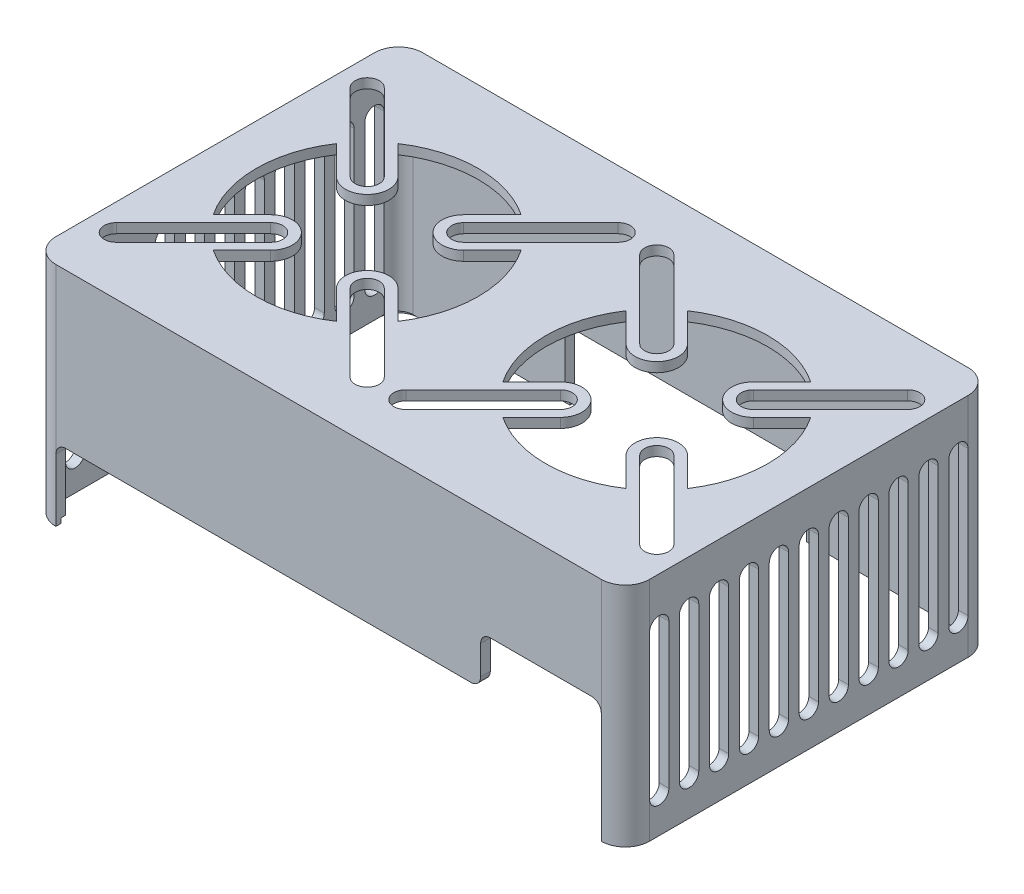
from build123d import *

# Parameters (mm, degrees)
BOSS_EXTRUDE1_DEPTH = 45
CUT_EXTRUDE2_START  = -45
CUT_EXTRUDE2_DEPTH  = 1
CUT_EXTRUDE3_REACH  = 109.626
SKETCH3_W           = 50
SKETCH3_H           = 15
CUT_EXTRUDE4_REACH  = 109.626
SKETCH4_W           = 113
SKETCH4_H           = 15
CUT_EXTRUDE6_DEPTH  = 137.374484417
LPATTERN2_COUNT     = 11
LPATTERN2_PITCH     = 6.2
BOSS_EXTRUDE2_DEPTH = 2
CUT_EXTRUDE7_DEPTH  = 87.227895718
SKETCH8_W           = 25
SKETCH8_H           = 10
CUT_EXTRUDE8_DEPTH  = 2
FILLET1_R           = 2
FILLET2_R           = 2
FILLET3_R           = 2
FILLET4_R           = 2


with BuildPart() as part:
    # Sketch1 → Boss-Extrude1 (new body)
    with BuildSketch(Plane(origin=(0, 0, 0), x_dir=(1, 0, 0), z_dir=(0, 1, 0))):
        with BuildLine():
            Line((-56.5, -38), (56.5, -38))
            ThreePointArc((56.5, -38), (60.035533906, -36.535533906), (61.5, -33))
            Line((61.5, -33), (61.5, 33))
            ThreePointArc((61.5, 33), (60.035533906, 36.535533906), (56.5, 38))
            Line((56.5, 38), (-56.5, 38))
            ThreePointArc((-56.5, 38), (-60.035533906, 36.535533906), (-61.5, 33))
            Line((-61.5, 33), (-61.5, -33))
            ThreePointArc((-61.5, -33), (-60.035533906, -36.535533906), (-56.5, -38))
        make_face()
        with BuildLine():
            Line((-59.5, -33), (-59.5, 33))
            ThreePointArc((-59.5, 33), (-58.621320344, 35.121320344), (-56.5, 36))
            Line((-56.5, 36), (56.5, 36))
            ThreePointArc((56.5, 36), (58.621320344, 35.121320344), (59.5, 33))
            Line((59.5, 33), (59.5, -33))
            ThreePointArc((59.5, -33), (58.621320344, -35.121320344), (56.5, -36))
            Line((56.5, -36), (-56.5, -36))
            ThreePointArc((-56.5, -36), (-58.621320344, -35.121320344), (-59.5, -33))
        make_face(mode=Mode.SUBTRACT)
    extrude(amount=BOSS_EXTRUDE1_DEPTH)

    # Sketch2 → Cut-Extrude2 (cut)
    with BuildSketch(Plane(origin=(0, 45, 0), x_dir=(1, 0, 0), z_dir=(0, 1, 0)).offset(CUT_EXTRUDE2_START)):
        with BuildLine():
            Line((-56.5, -37), (56.5, -37))
            ThreePointArc((56.5, -37), (59.328427125, -35.828427125), (60.5, -33))
            Line((60.5, -33), (60.5, 33))
            ThreePointArc((60.5, 33), (59.328427125, 35.828427125), (56.5, 37))
            Line((56.5, 37), (-56.5, 37))
            ThreePointArc((-56.5, 37), (-59.328427125, 35.828427125), (-60.5, 33))
            Line((-60.5, 33), (-60.5, -33))
            ThreePointArc((-60.5, -33), (-59.328427125, -35.828427125), (-56.5, -37))
        make_face()
        with BuildLine():
            Line((-59.5, 33), (-59.5, -33))
            ThreePointArc((-59.5, -33), (-58.621320344, -35.121320344), (-56.5, -36))
            Line((-56.5, -36), (56.5, -36))
            ThreePointArc((56.5, -36), (58.621320344, -35.121320344), (59.5, -33))
            Line((59.5, -33), (59.5, 33))
            ThreePointArc((59.5, 33), (58.621320344, 35.121320344), (56.5, 36))
            Line((56.5, 36), (-56.5, 36))
            ThreePointArc((-56.5, 36), (-58.621320344, 35.121320344), (-59.5, 33))
        make_face(mode=Mode.SUBTRACT)
    extrude(amount=CUT_EXTRUDE2_DEPTH, mode=Mode.SUBTRACT)

    # Cut-Extrude3: up to this face of the body (flat: up to its plane)
    cut_extrude3_end = Plane(part.part.faces().sort_by_distance((0, 23, -36))[0])
    # Sketch3 → Cut-Extrude3 (cut, up to the picked face)
    with BuildSketch(Plane(origin=(0, 0, -38), x_dir=(-1, 0, 0), z_dir=(0, 0, -1)), mode=Mode.PRIVATE) as cut_extrude3_sk1:
        with Locations((0, 7.5)):
            Rectangle(SKETCH3_W, SKETCH3_H)
    cut_extrude3_tool1 = split(extrude(cut_extrude3_sk1.sketch, amount=-CUT_EXTRUDE3_REACH, mode=Mode.PRIVATE), bisect_by=cut_extrude3_end, keep=Keep.BOTH, mode=Mode.PRIVATE)
    add(cut_extrude3_tool1.solids().sort_by(Axis((0, 7.5, -38), (0, 0, 1)))[0], mode=Mode.SUBTRACT)

    # Cut-Extrude4: up to this face of the body (flat: up to its plane)
    cut_extrude4_end = Plane(part.part.faces().sort_by_distance((0, 23, 36))[0])
    # Sketch4 → Cut-Extrude4 (cut, up to the picked face)
    with BuildSketch(Plane.XY.offset(38), mode=Mode.PRIVATE) as cut_extrude4_sk1:
        with Locations((0, 7.5)):
            Rectangle(SKETCH4_W, SKETCH4_H)
    cut_extrude4_tool1 = split(extrude(cut_extrude4_sk1.sketch, amount=-CUT_EXTRUDE4_REACH, mode=Mode.PRIVATE), bisect_by=cut_extrude4_end, keep=Keep.BOTH, mode=Mode.PRIVATE)
    add(cut_extrude4_tool1.solids().sort_by(Axis((0, 7.5, 38), (0, 0, -1)))[0], mode=Mode.SUBTRACT)

    # Sketch5 → Cut-Extrude6 (cut, symmetric)
    with BuildSketch(Plane.ZY.offset(61.5)):
        with BuildLine():
            Line((-29, 37.5), (-29, 7.5))
            ThreePointArc((-29, 7.5), (-31, 5.5), (-33, 7.5))
            Line((-33, 7.5), (-33, 37.5))
            ThreePointArc((-33, 37.5), (-31, 39.5), (-29, 37.5))
        make_face()
    cut_extrude6 = extrude(amount=CUT_EXTRUDE6_DEPTH, both=True, mode=Mode.SUBTRACT)

    # LPattern2: Cut-Extrude6 ×11
    with Locations(*[(0, 0, i * LPATTERN2_PITCH) for i in range(1, LPATTERN2_COUNT)]):
        add(cut_extrude6, mode=Mode.SUBTRACT)

    # Sketch6 → Boss-Extrude2 (add)
    with BuildSketch(Plane(origin=(0, 45, 0), x_dir=(1, 0, 0), z_dir=(0, 1, 0))):
        with BuildLine():
            Line((-56.5, -38), (56.5, -38))
            ThreePointArc((56.5, -38), (60.035533906, -36.535533906), (61.5, -33))
            Line((61.5, -33), (61.5, 33))
            ThreePointArc((61.5, 33), (60.035533906, 36.535533906), (56.5, 38))
            Line((56.5, 38), (-56.5, 38))
            ThreePointArc((-56.5, 38), (-60.035533906, 36.535533906), (-61.5, 33))
            Line((-61.5, 33), (-61.5, -33))
            ThreePointArc((-61.5, -33), (-60.035533906, -36.535533906), (-56.5, -38))
        make_face()
    extrude(amount=BOSS_EXTRUDE2_DEPTH)

    # Sketch7 → Cut-Extrude7 (cut, through all)
    with BuildSketch(Plane(origin=(0, 47, 0), x_dir=(1, 0, 0), z_dir=(0, 1, 0))):
        with BuildLine():
            ThreePointArc((-17.232842608, 19.131118423), (-30, 23), (-42.767157392, 19.131118423))
            Line((-42.767157392, 19.131118423), (-36.818019485, 13.181980515))
            ThreePointArc((-36.818019485, 13.181980515), (-36.818019485, 6.818019485), (-43.181980515, 6.818019485))
            Line((-43.181980515, 6.818019485), (-49.131118423, 12.767157392))
            ThreePointArc((-49.131118423, 12.767157392), (-53, 0), (-49.131118423, -12.767157392))
            Line((-49.131118423, -12.767157392), (-43.181980515, -6.818019485))
            ThreePointArc((-43.181980515, -6.818019485), (-36.818019485, -6.818019485), (-36.818019485, -13.181980515))
            Line((-36.818019485, -13.181980515), (-42.767157392, -19.131118423))
            ThreePointArc((-42.767157392, -19.131118423), (-30, -23), (-17.232842608, -19.131118423))
            Line((-17.232842608, -19.131118423), (-23.181980515, -13.181980515))
            ThreePointArc((-23.181980515, -13.181980515), (-23.181980515, -6.818019485), (-16.818019485, -6.818019485))
            Line((-16.818019485, -6.818019485), (-10.868881577, -12.767157392))
            ThreePointArc((-10.868881577, -12.767157392), (-7.988460711, -6.670242734), (-7, 0))
            ThreePointArc((-7, 0), (-7.988460711, 6.670242734), (-10.868881577, 12.767157392))
            Line((-10.868881577, 12.767157392), (-16.818019485, 6.818019485))
            ThreePointArc((-16.818019485, 6.818019485), (-23.181980515, 6.818019485), (-23.181980515, 13.181980515))
            Line((-23.181980515, 13.181980515), (-17.232842608, 19.131118423))
        make_face()
        with BuildLine():
            Line((-41.767766953, -8.232233047), (-47.934863167, -14.399329261))
            ThreePointArc((-47.934863167, -14.399329261), (-46.263455967, -16.263455967), (-44.399329261, -17.934863167))
            Line((-44.399329261, -17.934863167), (-38.232233047, -11.767766953))
            ThreePointArc((-38.232233047, -11.767766953), (-38.232233047, -8.232233047), (-41.767766953, -8.232233047))
        make_face()
        with BuildLine():
            ThreePointArc((-44.399329261, -17.934863167), (-46.263455967, -16.263455967), (-47.934863167, -14.399329261))
            Line((-47.934863167, -14.399329261), (-57.767766953, -24.232233047))
            ThreePointArc((-57.767766953, -24.232233047), (-57.767766953, -27.767766953), (-54.232233047, -27.767766953))
            Line((-54.232233047, -27.767766953), (-44.399329261, -17.934863167))
        make_face()
        with BuildLine():
            Line((-2.232233047, -24.232233047), (-12.065136833, -14.399329261))
            ThreePointArc((-12.065136833, -14.399329261), (-13.736544033, -16.263455967), (-15.600670739, -17.934863167))
            Line((-15.600670739, -17.934863167), (-5.767766953, -27.767766953))
            ThreePointArc((-5.767766953, -27.767766953), (-2.232233047, -27.767766953), (-2.232233047, -24.232233047))
        make_face()
        with BuildLine():
            ThreePointArc((-15.600670739, -17.934863167), (-13.736544033, -16.263455967), (-12.065136833, -14.399329261))
            Line((-12.065136833, -14.399329261), (-18.232233047, -8.232233047))
            ThreePointArc((-18.232233047, -8.232233047), (-21.767766953, -8.232233047), (-21.767766953, -11.767766953))
            Line((-21.767766953, -11.767766953), (-15.600670739, -17.934863167))
        make_face()
        with BuildLine():
            ThreePointArc((-12.065136833, 14.399329261), (-13.736544033, 16.263455967), (-15.600670739, 17.934863167))
            Line((-15.600670739, 17.934863167), (-21.767766953, 11.767766953))
            ThreePointArc((-21.767766953, 11.767766953), (-21.767766953, 8.232233047), (-18.232233047, 8.232233047))
            Line((-18.232233047, 8.232233047), (-12.065136833, 14.399329261))
        make_face()
        with BuildLine():
            Line((-5.767766953, 27.767766953), (-15.600670739, 17.934863167))
            ThreePointArc((-15.600670739, 17.934863167), (-13.736544033, 16.263455967), (-12.065136833, 14.399329261))
            Line((-12.065136833, 14.399329261), (-2.232233047, 24.232233047))
            ThreePointArc((-2.232233047, 24.232233047), (-2.232233047, 27.767766953), (-5.767766953, 27.767766953))
        make_face()
        with BuildLine():
            Line((-44.399329261, 17.934863167), (-54.232233047, 27.767766953))
            ThreePointArc((-54.232233047, 27.767766953), (-57.767766953, 27.767766953), (-57.767766953, 24.232233047))
            Line((-57.767766953, 24.232233047), (-47.934863167, 14.399329261))
            ThreePointArc((-47.934863167, 14.399329261), (-46.263455967, 16.263455967), (-44.399329261, 17.934863167))
        make_face()
        with BuildLine():
            Line((-38.232233047, 11.767766953), (-44.399329261, 17.934863167))
            ThreePointArc((-44.399329261, 17.934863167), (-46.263455967, 16.263455967), (-47.934863167, 14.399329261))
            Line((-47.934863167, 14.399329261), (-41.767766953, 8.232233047))
            ThreePointArc((-41.767766953, 8.232233047), (-38.232233047, 8.232233047), (-38.232233047, 11.767766953))
        make_face()
        with BuildLine():
            ThreePointArc((12.065136833, 14.399329261), (13.736544033, 16.263455967), (15.600670739, 17.934863167))
            Line((15.600670739, 17.934863167), (5.767766953, 27.767766953))
            ThreePointArc((5.767766953, 27.767766953), (2.232233047, 27.767766953), (2.232233047, 24.232233047))
            Line((2.232233047, 24.232233047), (12.065136833, 14.399329261))
        make_face()
        with BuildLine():
            Line((21.767766953, 11.767766953), (15.600670739, 17.934863167))
            ThreePointArc((15.600670739, 17.934863167), (13.736544033, 16.263455967), (12.065136833, 14.399329261))
            Line((12.065136833, 14.399329261), (18.232233047, 8.232233047))
            ThreePointArc((18.232233047, 8.232233047), (21.767766953, 8.232233047), (21.767766953, 11.767766953))
        make_face()
        with BuildLine():
            Line((18.232233047, -8.232233047), (12.065136833, -14.399329261))
            ThreePointArc((12.065136833, -14.399329261), (13.736544033, -16.263455967), (15.600670739, -17.934863167))
            Line((15.600670739, -17.934863167), (21.767766953, -11.767766953))
            ThreePointArc((21.767766953, -11.767766953), (21.767766953, -8.232233047), (18.232233047, -8.232233047))
        make_face()
        with BuildLine():
            ThreePointArc((15.600670739, -17.934863167), (13.736544033, -16.263455967), (12.065136833, -14.399329261))
            Line((12.065136833, -14.399329261), (2.232233047, -24.232233047))
            ThreePointArc((2.232233047, -24.232233047), (2.232233047, -27.767766953), (5.767766953, -27.767766953))
            Line((5.767766953, -27.767766953), (15.600670739, -17.934863167))
        make_face()
        with BuildLine():
            Line((38.232233047, -11.767766953), (44.399329261, -17.934863167))
            ThreePointArc((44.399329261, -17.934863167), (46.263455967, -16.263455967), (47.934863167, -14.399329261))
            Line((47.934863167, -14.399329261), (41.767766953, -8.232233047))
            ThreePointArc((41.767766953, -8.232233047), (38.232233047, -8.232233047), (38.232233047, -11.767766953))
        make_face()
        with BuildLine():
            ThreePointArc((47.934863167, -14.399329261), (46.263455967, -16.263455967), (44.399329261, -17.934863167))
            Line((44.399329261, -17.934863167), (54.232233047, -27.767766953))
            ThreePointArc((54.232233047, -27.767766953), (57.767766953, -27.767766953), (57.767766953, -24.232233047))
            Line((57.767766953, -24.232233047), (47.934863167, -14.399329261))
        make_face()
        with BuildLine():
            ThreePointArc((47.934863167, 14.399329261), (46.263455967, 16.263455967), (44.399329261, 17.934863167))
            Line((44.399329261, 17.934863167), (38.232233047, 11.767766953))
            ThreePointArc((38.232233047, 11.767766953), (38.232233047, 8.232233047), (41.767766953, 8.232233047))
            Line((41.767766953, 8.232233047), (47.934863167, 14.399329261))
        make_face()
        with BuildLine():
            Line((54.232233047, 27.767766953), (44.399329261, 17.934863167))
            ThreePointArc((44.399329261, 17.934863167), (46.263455967, 16.263455967), (47.934863167, 14.399329261))
            Line((47.934863167, 14.399329261), (57.767766953, 24.232233047))
            ThreePointArc((57.767766953, 24.232233047), (57.767766953, 27.767766953), (54.232233047, 27.767766953))
        make_face()
        with BuildLine():
            ThreePointArc((42.767157392, 19.131118423), (30, 23), (17.232842608, 19.131118423))
            Line((17.232842608, 19.131118423), (23.181980515, 13.181980515))
            ThreePointArc((23.181980515, 13.181980515), (23.181980515, 6.818019485), (16.818019485, 6.818019485))
            Line((16.818019485, 6.818019485), (10.868881577, 12.767157392))
            ThreePointArc((10.868881577, 12.767157392), (7, 0), (10.868881577, -12.767157392))
            Line((10.868881577, -12.767157392), (16.818019485, -6.818019485))
            ThreePointArc((16.818019485, -6.818019485), (23.181980515, -6.818019485), (23.181980515, -13.181980515))
            Line((23.181980515, -13.181980515), (17.232842608, -19.131118423))
            ThreePointArc((17.232842608, -19.131118423), (30, -23), (42.767157392, -19.131118423))
            Line((42.767157392, -19.131118423), (36.818019485, -13.181980515))
            ThreePointArc((36.818019485, -13.181980515), (36.818019485, -6.818019485), (43.181980515, -6.818019485))
            Line((43.181980515, -6.818019485), (49.131118423, -12.767157392))
            ThreePointArc((49.131118423, -12.767157392), (52.011539289, -6.670242734), (53, 0))
            ThreePointArc((53, 0), (52.011539289, 6.670242734), (49.131118423, 12.767157392))
            Line((49.131118423, 12.767157392), (43.181980515, 6.818019485))
            ThreePointArc((43.181980515, 6.818019485), (36.818019485, 6.818019485), (36.818019485, 13.181980515))
            Line((36.818019485, 13.181980515), (42.767157392, 19.131118423))
        make_face()
    extrude(amount=-CUT_EXTRUDE7_DEPTH, mode=Mode.SUBTRACT)

    # Sketch8 → Cut-Extrude8 (cut)
    with BuildSketch(Plane.XY.offset(38)):
        with Locations((44, 20)):
            Rectangle(SKETCH8_W, SKETCH8_H)
    extrude(amount=-CUT_EXTRUDE8_DEPTH, mode=Mode.SUBTRACT)

    # Fillet1
    fillet1_edges = [part.edges().sort_by_distance(p)[0] for p in [
        (31.5, 15, 37),
    ]]
    fillet(fillet1_edges, radius=FILLET1_R)

    # Fillet2
    fillet2_edges = [part.edges().sort_by_distance(p)[0] for p in [
        (31.5, 25, 37),
    ]]
    fillet(fillet2_edges, radius=FILLET2_R)

    # Fillet3
    fillet3_edges = [part.edges().sort_by_distance(p)[0] for p in [
        (-25, 15, -37),
        (25, 15, -37),
    ]]
    fillet(fillet3_edges, radius=FILLET3_R)

    # Fillet4
    # the kernel refuses this fillet: 2 mm, written as the material it adds along each edge
    with BuildSketch(Plane(origin=(-56.5, 15, 38), x_dir=(0, -1, 0), z_dir=(0, 0, -1))) as fillet4_piece_1:
        with BuildLine():
            CenterArc((FILLET4_R, -FILLET4_R), FILLET4_R, 90, 90)
            Line((0, -FILLET4_R), (0, 0))
            Line((0, 0), (FILLET4_R, 0))
        make_face()
    extrude(amount=2)
    with BuildSketch(Plane(origin=(56.5, 25, 38), x_dir=(0, -1, 0), z_dir=(0, 0, -1))) as fillet4_piece_2:
        with BuildLine():
            CenterArc((FILLET4_R, FILLET4_R), FILLET4_R, 180, 90)
            Line((0, FILLET4_R), (0, 0))
            Line((0, 0), (FILLET4_R, 0))
        make_face()
    extrude(amount=2)


solid = part.part
